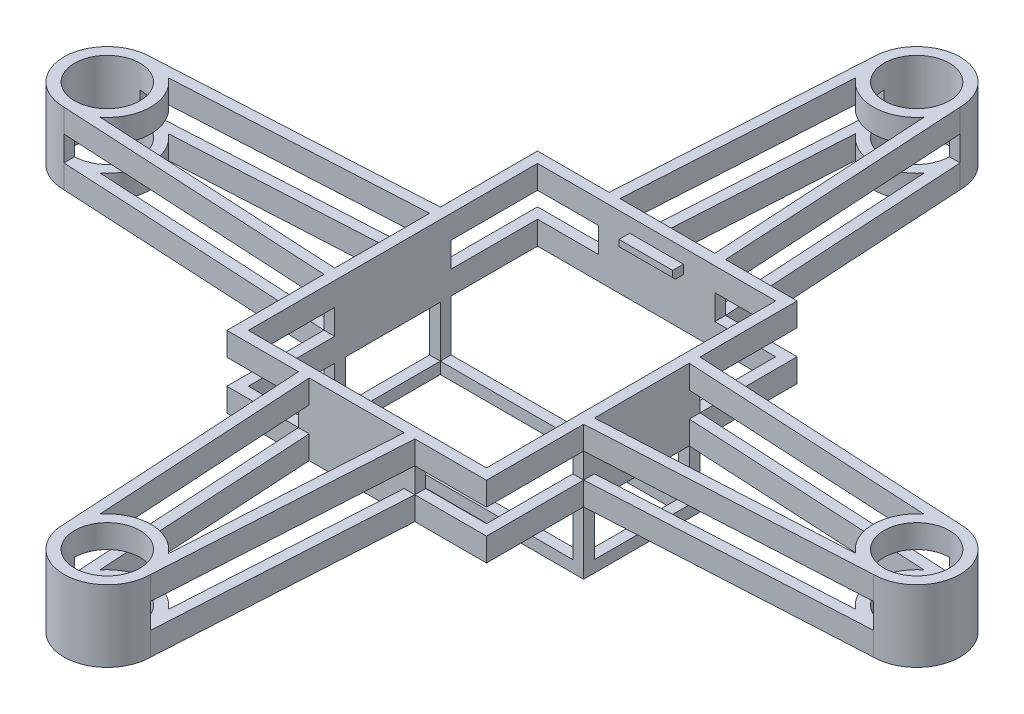
from build123d import *

# Parameters (mm, degrees)
SKETCH1_R               = 3.65
SKETCH1_W               = 26.6
SKETCH1_H               = 32.3
BOSS_EXTRUDE1_DEPTH     = 8
SKETCH2_W               = 3
SKETCH2_H               = 0.7
BOSS_EXTRUDE2_DEPTH     = 1.2
SKETCH3_W               = 3
SKETCH3_H               = 0.7
BOSS_EXTRUDE3_DEPTH     = 1.2
CHAMFER1_SIZE           = 1.2
CUT_EXTRUDE1_DEPTH      = 85.642077968
CUT_EXTRUDE1_DEPTH_BACK = 85.642077968
SKETCH4_W               = 48.801078557
SKETCH4_H               = 1.4
SKETCH4_W_2             = 10.59579159
SKETCH4_W_3             = 46.838011079
BOSS_EXTRUDE4_START     = -5.4
SKETCH5_W               = 13
SKETCH5_H               = 1.2
SKETCH5_W_2             = 1.2
SKETCH5_H_2             = 13
BOSS_EXTRUDE4_DEPTH     = 2.8
BOSS_EXTRUDE5_REACH     = 77.99
SKETCH7_W               = 1.2
SKETCH7_H               = 1.202104206
SKETCH7_H_2             = 1.201731925
BOSS_EXTRUDE6_DEPTH     = 7
SKETCH8_W               = 1.202104206
SKETCH8_H               = 1.3
SKETCH8_W_2             = 1.201731925
BOSS_EXTRUDE7_DEPTH     = 26.6
SKETCH9_W               = 1.2
SKETCH9_H               = 1.3
BOSS_EXTRUDE8_DEPTH     = 11.797895795


with BuildPart() as part:
    # Sketch1 → Boss-Extrude1 (new body)
    with BuildSketch(Plane(origin=(0, 0, 0), x_dir=(1, 0, 0), z_dir=(0, 1, 0))):
        with BuildLine():
            Line((-7.021942446, 23.451798561), (-15.021942446, 23.451798561))
            Line((-15.021942446, 23.451798561), (-15.021942446, 12.601798561))
            Line((-15.021942446, 12.601798561), (-45.721942446, 10.951798561))
            ThreePointArc((-45.721942446, 10.951798561), (-50.571942446, 6.101798561), (-45.721942446, 1.251798561))
            Line((-45.721942446, 1.251798561), (-15.021942446, -0.398201439))
            Line((-15.021942446, -0.398201439), (-15.021942446, -11.248201439))
            Line((-15.021942446, -11.248201439), (-7.021942446, -11.248201439))
            Line((-7.021942446, -11.248201439), (-5.371942446, -39.098201439))
            ThreePointArc((-5.371942446, -39.098201439), (-0.521942446, -43.948201439), (4.328057554, -39.098201439))
            Line((4.328057554, -39.098201439), (5.978057554, -11.248201439))
            Line((5.978057554, -11.248201439), (13.978057554, -11.248201439))
            Line((13.978057554, -11.248201439), (13.978057554, -0.398201439))
            Line((13.978057554, -0.398201439), (44.678057554, 1.251798561))
            ThreePointArc((44.678057554, 1.251798561), (49.528057554, 6.101798561), (44.678057554, 10.951798561))
            Line((44.678057554, 10.951798561), (13.978057554, 12.601798561))
            Line((13.978057554, 12.601798561), (13.978057554, 23.451798561))
            Line((13.978057554, 23.451798561), (5.978057554, 23.451798561))
            Line((5.978057554, 23.451798561), (4.328057554, 51.301798561))
            ThreePointArc((4.328057554, 51.301798561), (-0.521942446, 56.151798561), (-5.371942446, 51.301798561))
            Line((-5.371942446, 51.301798561), (-7.021942446, 23.451798561))
        make_face()
        with Locations(Location((-0.521942446, -39.098201439, 0), (0, 0, 270))):
            Circle(SKETCH1_R, mode=Mode.SUBTRACT)
        with BuildLine():
            Line((4.775953349, -11.248201439), (3.302651218, -36.115755579))
            ThreePointArc((3.302651218, -36.115755579), (-0.521942446, -34.248201439), (-4.34653611, -36.115755579))
            Line((-4.34653611, -36.115755579), (-5.819838241, -11.248201439))
            Line((-5.819838241, -11.248201439), (4.775953349, -11.248201439))
        make_face(mode=Mode.SUBTRACT)
        with Locations(Location((-45.721942446, 6.101798561, 0), (0, 0, 270))):
            Circle(SKETCH1_R, mode=Mode.SUBTRACT)
        with BuildLine():
            Line((-42.720356894, 9.911389638), (-15.021942446, 11.400066636))
            Line((-15.021942446, 11.400066636), (-15.021942446, 0.803530486))
            Line((-15.021942446, 0.803530486), (-42.720356894, 2.292207484))
            ThreePointArc((-42.720356894, 2.292207484), (-40.871942446, 6.101798561), (-42.720356894, 9.911389638))
        make_face(mode=Mode.SUBTRACT)
        with Locations((-0.521942446, 6.101798561)):
            Rectangle(SKETCH1_W, SKETCH1_H, mode=Mode.SUBTRACT)
        with BuildLine():
            Line((-5.819838241, 23.451798561), (-4.34653611, 48.319352702))
            ThreePointArc((-4.34653611, 48.319352702), (-0.521942446, 46.451798561), (3.302651218, 48.319352702))
            Line((3.302651218, 48.319352702), (4.775953349, 23.451798561))
            Line((4.775953349, 23.451798561), (-5.819838241, 23.451798561))
        make_face(mode=Mode.SUBTRACT)
        with Locations(Location((-0.521942446, 51.301798561, 0), (0, 0, 270))):
            Circle(SKETCH1_R, mode=Mode.SUBTRACT)
        with BuildLine():
            Line((41.676472002, 2.292207484), (13.978057554, 0.803530486))
            Line((13.978057554, 0.803530486), (13.978057554, 11.400066636))
            Line((13.978057554, 11.400066636), (41.676472002, 9.911389638))
            ThreePointArc((41.676472002, 9.911389638), (39.828057554, 6.101798561), (41.676472002, 2.292207484))
        make_face(mode=Mode.SUBTRACT)
        with Locations(Location((44.678057554, 6.101798561, 0), (0, 0, 270))):
            Circle(SKETCH1_R, mode=Mode.SUBTRACT)
    extrude(amount=BOSS_EXTRUDE1_DEPTH)

    # Sketch2 → Boss-Extrude2 (add)
    with BuildSketch(Plane.XY.offset(-22.251798561)):
        with Locations((-2.021942446, 6.05)):
            Rectangle(SKETCH2_W, SKETCH2_H)
        with Locations((0.978057554, 6.05)):
            Rectangle(SKETCH2_W, SKETCH2_H)
    extrude(amount=BOSS_EXTRUDE2_DEPTH)

    # Sketch3 → Boss-Extrude3 (add)
    with BuildSketch(Plane(origin=(0, 0, 10.048201439), x_dir=(-1, 0, 0), z_dir=(0, 0, -1))):
        with Locations((-0.978057554, 6.05)):
            Rectangle(SKETCH3_W, SKETCH3_H)
        with Locations((2.021942446, 6.05)):
            Rectangle(SKETCH3_W, SKETCH3_H)
    extrude(amount=BOSS_EXTRUDE3_DEPTH)

    # Chamfer1
    chamfer1_edges = [part.edges().sort_by_distance(p)[0] for p in [
        (-0.521942446, 5.7, -22.251798561),
        (-0.521942446, 5.7, 10.048201439),
    ]]
    chamfer(chamfer1_edges, length=CHAMFER1_SIZE - 0.0001)  # a hair under: the kernel refuses the full size

    # Sketch4 → Cut-Extrude1 (cut, two sides: drawn at the far end of the back side and taken through both)
    with BuildSketch(Plane(origin=(0, 0, -23.451798561), x_dir=(-1, 0, 0), z_dir=(0, 0, -1)).offset(-CUT_EXTRUDE1_DEPTH_BACK)):
        with Locations((-29.176492628, 3.3)):
            Rectangle(SKETCH4_W, SKETCH4_H)
        with Locations((-29.176492628, 4.7)):
            Rectangle(SKETCH4_W, SKETCH4_H)
        with Locations((0.521942446, 4.7)):
            Rectangle(SKETCH4_W_2, SKETCH4_H)
        with Locations((0.521942446, 3.3)):
            Rectangle(SKETCH4_W_2, SKETCH4_H)
        with Locations((29.238843781, 3.3)):
            Rectangle(SKETCH4_W_3, SKETCH4_H)
        with Locations((29.238843781, 4.7)):
            Rectangle(SKETCH4_W_3, SKETCH4_H)
    extrude(amount=CUT_EXTRUDE1_DEPTH + CUT_EXTRUDE1_DEPTH_BACK, mode=Mode.SUBTRACT)


with BuildPart() as cut_extrude1_piece_1:
    # of the separate pieces the step leaves, piece 1, a body of its own (cut_extrude1_pieces)
    add(part.part.solids().sort_by_distance((-3.521942446, 6.4, 10.048201439))[0])



with BuildPart() as cut_extrude1_piece_2:
    # of the separate pieces the step leaves, piece 2, a body of its own (cut_extrude1_pieces)
    add(part.part.solids().sort_by_distance((12.778057554, 2.6, 10.048201439))[0])


with BuildPart() as cut_extrude1_piece_1_1:
    add(cut_extrude1_piece_1.part)

    add(cut_extrude1_piece_2.part)  # Boss-Extrude4 merges Cut-Extrude1 piece 2
    # Sketch5 → Boss-Extrude4 (add)
    with BuildSketch(Plane(origin=(0, 8, 0), x_dir=(1, 0, 0), z_dir=(0, 1, 0)).offset(BOSS_EXTRUDE4_START)):
        with Locations((-0.521942446, 22.851798561)):
            Rectangle(SKETCH5_W, SKETCH5_H)
        with Locations((-0.521942446, -10.648201439)):
            Rectangle(SKETCH5_W, SKETCH5_H)
        with Locations((-14.421942446, 6.101798561)):
            Rectangle(SKETCH5_W_2, SKETCH5_H_2)
        with Locations((13.378057554, 6.101798561)):
            Rectangle(SKETCH5_W_2, SKETCH5_H_2)
    extrude(amount=BOSS_EXTRUDE4_DEPTH)

    # Sketch6 → Boss-Extrude5 (add, up to next)
    with BuildSketch(Plane(origin=(0, 8, 0), x_dir=(1, 0, 0), z_dir=(0, 1, 0)), mode=Mode.PRIVATE) as boss_extrude5_sk1:
        with BuildLine():
            Line((-5.371942446, 51.301798561), (-4.171942446, 51.301798561))
            ThreePointArc((-4.171942446, 51.301798561), (-0.521942446, 54.951798561), (3.128057554, 51.301798561))
            Line((3.128057554, 51.301798561), (4.328057554, 51.301798561))
            ThreePointArc((4.328057554, 51.301798561), (-0.521942446, 56.151798561), (-5.371942446, 51.301798561))
        make_face()
    boss_extrude5_tool1 = extrude(boss_extrude5_sk1.sketch, amount=-BOSS_EXTRUDE5_REACH, mode=Mode.PRIVATE) - cut_extrude1_piece_1_1.part
    # Sketch6 → Boss-Extrude5 (add, up to next)
    with BuildSketch(Plane(origin=(0, 8, 0), x_dir=(1, 0, 0), z_dir=(0, 1, 0)), mode=Mode.PRIVATE) as boss_extrude5_sk2:
        with BuildLine():
            Line((3.128057554, -39.098201439), (4.328057554, -39.098201439))
            ThreePointArc((4.328057554, -39.098201439), (-0.521942446, -43.948201439), (-5.371942446, -39.098201439))
            Line((-5.371942446, -39.098201439), (-4.171942446, -39.098201439))
            ThreePointArc((-4.171942446, -39.098201439), (-0.521942446, -42.748201439), (3.128057554, -39.098201439))
        make_face()
    boss_extrude5_tool2 = extrude(boss_extrude5_sk2.sketch, amount=-BOSS_EXTRUDE5_REACH, mode=Mode.PRIVATE) - cut_extrude1_piece_1_1.part
    # Sketch6 → Boss-Extrude5 (add, up to next)
    with BuildSketch(Plane(origin=(0, 8, 0), x_dir=(1, 0, 0), z_dir=(0, 1, 0)), mode=Mode.PRIVATE) as boss_extrude5_sk3:
        with BuildLine():
            Line((44.678057554, 9.751798561), (44.678057554, 10.951798561))
            ThreePointArc((44.678057554, 10.951798561), (49.528057554, 6.101798561), (44.678057554, 1.251798561))
            Line((44.678057554, 1.251798561), (44.678057554, 2.451798561))
            ThreePointArc((44.678057554, 2.451798561), (48.328057554, 6.101798561), (44.678057554, 9.751798561))
        make_face()
    boss_extrude5_tool3 = extrude(boss_extrude5_sk3.sketch, amount=-BOSS_EXTRUDE5_REACH, mode=Mode.PRIVATE) - cut_extrude1_piece_1_1.part
    # Sketch6 → Boss-Extrude5 (add, up to next)
    with BuildSketch(Plane(origin=(0, 8, 0), x_dir=(1, 0, 0), z_dir=(0, 1, 0)), mode=Mode.PRIVATE) as boss_extrude5_sk4:
        with BuildLine():
            Line((-45.721942446, 1.251798561), (-45.721942446, 2.451798561))
            ThreePointArc((-45.721942446, 2.451798561), (-49.371942446, 6.101798561), (-45.721942446, 9.751798561))
            Line((-45.721942446, 9.751798561), (-45.721942446, 10.951798561))
            ThreePointArc((-45.721942446, 10.951798561), (-50.571942446, 6.101798561), (-45.721942446, 1.251798561))
        make_face()
    boss_extrude5_tool4 = extrude(boss_extrude5_sk4.sketch, amount=-BOSS_EXTRUDE5_REACH, mode=Mode.PRIVATE) - cut_extrude1_piece_1_1.part
    add(boss_extrude5_tool1.solids().sort_by_distance((-4.771942, 8, -51.410248))[0])
    add(boss_extrude5_tool2.solids().sort_by_distance((-0.521942, 8, 43.839752))[0])
    add(boss_extrude5_tool3.solids().sort_by_distance((44.786507, 8, -10.351799))[0])
    add(boss_extrude5_tool4.solids().sort_by_distance((-45.830392, 8, -10.351799))[0])

    # Sketch7 → Boss-Extrude6 (add)
    with BuildSketch(Plane.XZ):
        with Locations((-14.421942446, -0.202850664)):
            Rectangle(SKETCH7_W, SKETCH7_H)
        with Locations((-14.421942446, -12.000932599)):
            Rectangle(SKETCH7_W, SKETCH7_H_2)
        with Locations((13.378057554, -0.202850664)):
            Rectangle(SKETCH7_W, SKETCH7_H)
        with Locations((13.378057554, -12.000932599)):
            Rectangle(SKETCH7_W, SKETCH7_H_2)
    extrude(amount=BOSS_EXTRUDE6_DEPTH)

    # Sketch8 → Boss-Extrude7 (add)
    with BuildSketch(Plane(origin=(-13.821942446, 0, 0), x_dir=(0, 0, -1), z_dir=(1, 0, 0))):
        with Locations((0.202850664, -6.35)):
            Rectangle(SKETCH8_W, SKETCH8_H)
        with Locations((12.000932599, -6.35)):
            Rectangle(SKETCH8_W_2, SKETCH8_H)
    extrude(amount=BOSS_EXTRUDE7_DEPTH)

    # Sketch9 → Boss-Extrude8 (add)
    with BuildSketch(Plane(origin=(0, 0, -12.601798561), x_dir=(-1, 0, 0), z_dir=(0, 0, -1))):
        with Locations((-13.378057554, -6.35)):
            Rectangle(SKETCH9_W, SKETCH9_H)
        with Locations((14.421942446, -6.35)):
            Rectangle(SKETCH9_W, SKETCH9_H)
    extrude(amount=-BOSS_EXTRUDE8_DEPTH)


solid = cut_extrude1_piece_1_1.part
